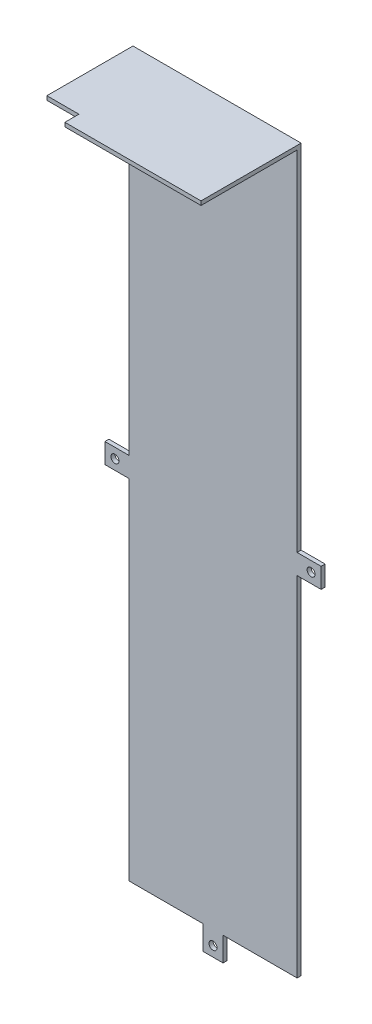
from build123d import *

# Parameters (mm, degrees)
SKETCH1_W            = 42
SKETCH1_H            = 25
BOSS_EXTRUDE1_DEPTH  = 1
SKETCH2_W            = 42
SKETCH2_H            = 1
BOSS_EXTRUDE2_DEPTH  = 179
SKETCH3_W            = 42
SKETCH3_H            = 1
BOSS_EXTRUDE3_DEPTH  = 2.1
SKETCH4_W            = 42
SKETCH4_H            = 1
BOSS_EXTRUDE4_DEPTH  = 15
SKETCH6_R            = 1.25
CUT_EXTRUDE1_DEPTH   = 15
SKETCH7_W            = 42
SKETCH7_H            = 1.67
CUT_EXTRUDE2_DEPTH   = 15
SKETCH8_W            = 8
SKETCH8_H            = 3.5
CUT_EXTRUDE3_DEPTH   = 15
SKETCH9_W            = 42
SKETCH9_H            = 14.33
CUT_EXTRUDE4_DEPTH   = 10
SKETCH10_W           = 5
SKETCH10_H           = 6
BOSS_EXTRUDE5_DEPTH  = 1
SKETCH11_R           = 1
CUT_EXTRUDE5_DEPTH   = 1
SKETCH12_W           = 42
SKETCH12_H           = 1
BOSS_EXTRUDE6_DEPTH  = 9
SKETCH13_W           = 5
SKETCH13_H           = 6
BOSS_EXTRUDE8_DEPTH  = 1
SKETCH15_R           = 1
CUT_EXTRUDE7_DEPTH   = 1
SKETCH16_W           = 6
SKETCH16_H           = 5
BOSS_EXTRUDE9_DEPTH  = 1
SKETCH17_W           = 53
SKETCH17_H           = 5
BOSS_EXTRUDE10_DEPTH = 1
SKETCH18_R           = 1
CUT_EXTRUDE8_DEPTH   = 1
SKETCH20_W           = 1
SKETCH20_H           = 5
BOSS_EXTRUDE11_DEPTH = 1
SKETCH21_R           = 1
CUT_EXTRUDE9_DEPTH   = 1


with BuildPart() as part:
    # Sketch1 → Boss-Extrude1 (new body)
    with BuildSketch(Plane(origin=(0, 0, 0), x_dir=(1, 0, 0), z_dir=(0, 1, 0))):
        with Locations((4.315789474, -6.763157895)):
            Rectangle(SKETCH1_W, SKETCH1_H)
    extrude(amount=BOSS_EXTRUDE1_DEPTH)

    # Sketch2 → Boss-Extrude2 (add)
    with BuildSketch(Plane(origin=(0, 1, 0), x_dir=(1, 0, 0), z_dir=(0, 1, 0))):
        with Locations((4.315789474, 5.236842105)):
            Rectangle(SKETCH2_W, SKETCH2_H)
    extrude(amount=-BOSS_EXTRUDE2_DEPTH)

    # Sketch3 → Boss-Extrude3 (add)
    with BuildSketch(Plane.XZ.offset(178)):
        with Locations((4.315789474, -5.236842105)):
            Rectangle(SKETCH3_W, SKETCH3_H)
    extrude(amount=BOSS_EXTRUDE3_DEPTH)

    # Sketch4 → Boss-Extrude4 (add)
    with BuildSketch(Plane.XY.offset(-4.736842105)):
        with Locations((4.315789474, -179.6)):
            Rectangle(SKETCH4_W, SKETCH4_H)
    extrude(amount=BOSS_EXTRUDE4_DEPTH)

    # Sketch6 → Cut-Extrude1 (cut)
    with BuildSketch(Plane.XZ.offset(180.1)):
        with Locations((-6.684210526, 3.593157895)):
            Circle(SKETCH6_R)
        with Locations((15.315789474, 3.593157895)):
            Circle(SKETCH6_R)
    extrude(amount=-CUT_EXTRUDE1_DEPTH, mode=Mode.SUBTRACT)

    # Sketch7 → Cut-Extrude2 (cut)
    with BuildSketch(Plane.XZ.offset(180.1)):
        with Locations((4.315789474, 9.428157895)):
            Rectangle(SKETCH7_W, SKETCH7_H)
    extrude(amount=-CUT_EXTRUDE2_DEPTH, mode=Mode.SUBTRACT)

    # Sketch8 → Cut-Extrude3 (cut)
    with BuildSketch(Plane(origin=(0, 1, 0), x_dir=(1, 0, 0), z_dir=(0, 1, 0))):
        with Locations((-12.684210526, -17.513157895)):
            Rectangle(SKETCH8_W, SKETCH8_H)
    extrude(amount=-CUT_EXTRUDE3_DEPTH, mode=Mode.SUBTRACT)

    # Sketch9 → Cut-Extrude4 (cut)
    with BuildSketch(Plane.XZ.offset(180.1)):
        with Locations((4.315789474, 1.428157895)):
            Rectangle(SKETCH9_W, SKETCH9_H)
    extrude(amount=-CUT_EXTRUDE4_DEPTH, mode=Mode.SUBTRACT)

    # Sketch10 → Boss-Extrude5 (add)
    with BuildSketch(Plane(origin=(0, 0, -5.736842105), x_dir=(-1, 0, 0), z_dir=(0, 0, -1))):
        with Locations((-4.315789474, -173.1)):
            Rectangle(SKETCH10_W, SKETCH10_H)
    extrude(amount=-BOSS_EXTRUDE5_DEPTH)

    # Sketch11 → Cut-Extrude5 (cut)
    with BuildSketch(Plane(origin=(0, 0, -5.736842105), x_dir=(-1, 0, 0), z_dir=(0, 0, -1))):
        with Locations((-4.315789474, -173.6)):
            Circle(SKETCH11_R)
    extrude(amount=-CUT_EXTRUDE5_DEPTH, mode=Mode.SUBTRACT)

    # Sketch12 → Boss-Extrude6 (add)
    with BuildSketch(Plane.XZ.offset(170.1)):
        with Locations((4.315789474, -5.236842105)):
            Rectangle(SKETCH12_W, SKETCH12_H)
    extrude(amount=BOSS_EXTRUDE6_DEPTH)

    # Sketch13 → Boss-Extrude8 (add)
    with BuildSketch(Plane(origin=(0, 0, -5.736842105), x_dir=(-1, 0, 0), z_dir=(0, 0, -1))):
        with Locations((-4.315789474, -182.1)):
            Rectangle(SKETCH13_W, SKETCH13_H)
    extrude(amount=-BOSS_EXTRUDE8_DEPTH)

    # Sketch15 → Cut-Extrude7 (cut)
    with BuildSketch(Plane(origin=(0, 0, -5.736842105), x_dir=(-1, 0, 0), z_dir=(0, 0, -1))):
        with Locations((-4.315789474, -182.6)):
            Circle(SKETCH15_R)
    extrude(amount=-CUT_EXTRUDE7_DEPTH, mode=Mode.SUBTRACT)

    # Sketch16 → Boss-Extrude9 (add)
    with BuildSketch(Plane(origin=(0, 0, -5.736842105), x_dir=(-1, 0, 0), z_dir=(0, 0, -1))):
        with Locations((-28.315789474, -89.55)):
            Rectangle(SKETCH16_W, SKETCH16_H)
    extrude(amount=-BOSS_EXTRUDE9_DEPTH)

    # Sketch17 → Boss-Extrude10 (add)
    with BuildSketch(Plane(origin=(0, 0, -5.736842105), x_dir=(-1, 0, 0), z_dir=(0, 0, -1))):
        with Locations((-4.815789474, -89.55)):
            Rectangle(SKETCH17_W, SKETCH17_H)
    extrude(amount=-BOSS_EXTRUDE10_DEPTH)

    # Sketch18 → Cut-Extrude8 (cut)
    with BuildSketch(Plane(origin=(0, 0, -5.736842105), x_dir=(-1, 0, 0), z_dir=(0, 0, -1))):
        with Locations((-28.815789474, -89.55)):
            Circle(SKETCH18_R)
    extrude(amount=-CUT_EXTRUDE8_DEPTH, mode=Mode.SUBTRACT)

    # Sketch20 → Boss-Extrude11 (add)
    with BuildSketch(Plane.ZY.offset(21.684210526)):
        with Locations((-5.236842105, -89.55)):
            Rectangle(SKETCH20_W, SKETCH20_H)
    extrude(amount=BOSS_EXTRUDE11_DEPTH)

    # Sketch21 → Cut-Extrude9 (cut)
    with BuildSketch(Plane(origin=(0, 0, -5.736842105), x_dir=(-1, 0, 0), z_dir=(0, 0, -1))):
        with Locations((20.184210526, -89.55)):
            Circle(SKETCH21_R)
    extrude(amount=-CUT_EXTRUDE9_DEPTH, mode=Mode.SUBTRACT)


solid = part.part
